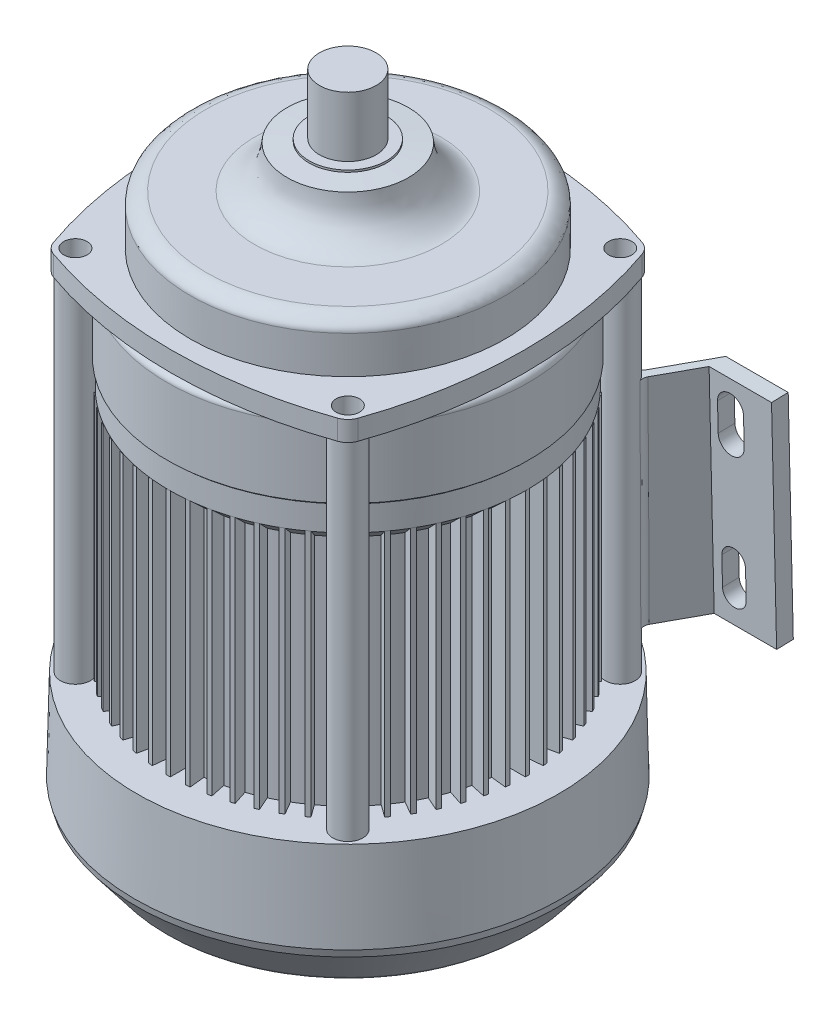
from build123d import *

# Parameters (mm, degrees)
BOSS_EXTRUDE2_REACH = 182.757
CIRPATTERN1_COUNT   = 60
BOSS_EXTRUDE5_START = -6
SKETCH6_R           = 3.5
BOSS_EXTRUDE5_DEPTH = 6
BOSS_EXTRUDE6_START = -110.05
SKETCH6_4_R         = 4.5
SKETCH6_4_R_2       = 3.5
BOSS_EXTRUDE6_DEPTH = 110.05
FILLET2_R           = 5
BOSS_EXTRUDE7_DEPTH = 5
BOSS_EXTRUDE8_DEPTH = 64.9
CUT_EXTRUDE1_START  = -110.05
SKETCH6_5_R         = 3.5
CUT_EXTRUDE1_DEPTH  = 110.05
FILLET3_R           = 2.5
BOSS_EXTRUDE9_DEPTH = 62
FILLET4_R           = 1


with BuildPart() as part:
    # Sketch3 → Revolve4 (revolve)
    with BuildSketch(Plane.XY, mode=Mode.PRIVATE) as revolve4_sk:
        with BuildLine():
            Line((0, -44.5), (0, 8))
            Line((0, 8), (-8.5, 8))
            Line((-8.5, 8), (-8.5, 0))
            Line((-8.5, 0), (-8.5, -10))
            Line((-8.5, -10), (-11.6, -10))
            Line((-11.6, -10), (-11.6, -10.603939151))
            Line((-11.6, -10.603939151), (-18.2, -11.06545611))
            add(Edge.make_bspline(
                [(-18.2, -11.06545611), (-18.483231897, -13.698371795), (-18.796132572, -16.549340939), (-22.617854847, -21.372660686), (-26.27087664, -23.603939151), (-27.95, -23.603939151)],
                knots=[0, 0, 0, 0, 0.4350294, 0.5350294, 1, 1, 1, 1], degree=3))
            Line((-27.95, -23.603939151), (-42.45, -23.603939151))
            add(Edge.make_bspline(
                [(-47.2, -27.253939151), (-47.2, -26.186888604), (-45.306003074, -24.445516164), (-43.516666667, -23.603939151), (-42.45, -23.603939151)],
                knots=[0, 0, 0, 0, 0.468038494, 1, 1, 1, 1], degree=3))
            Line((-47.2, -27.253939151), (-47.2, -44.5))
            Line((-47.2, -44.5), (0, -44.5))
        make_face()
        with BuildLine():
            Line((0, -197), (0, -44.5))
            Line((0, -44.5), (-47.2, -44.5))
            Line((-47.2, -44.5), (-52.9, -44.5))
            ThreePointArc((-52.9, -44.5), (-53.835376053, -45.192237589), (-54.191723747, -46.3))
            Line((-54.191723747, -46.3), (-54.191723747, -66.45))
            Line((-54.191723747, -66.45), (-53.548302521, -67.05))
            Line((-53.548302521, -67.05), (-53.548302521, -74.55))
            Line((-53.548302521, -74.55), (-49.258827681, -78.55))
            Line((-49.258827681, -78.55), (-49.258827681, -148.55))
            Line((-49.258827681, -148.55), (-63.258827681, -148.55))
            Line((-63.258827681, -148.55), (-63.895117946, -175.55))
            Line((-63.895117946, -175.55), (-63.258827681, -177.844388575))
            Line((-63.258827681, -177.844388575), (-54.43307337, -189.344388575))
            add(Edge.make_bspline(
                [(-54.43307337, -189.344388575), (-51.490412959, -193.178689139), (-12.578413701, -196.597750764), (-6.2, -197), (-2, -197)],
                knots=[0, 0, 0, 0, 0.440369242, 1, 1, 1, 1], degree=3))
            Line((-2, -197), (0, -197))
        make_face()
    revolve(revolve4_sk.sketch.rotate(Axis((0, 8, 0), (0, 1, 0)), 270), axis=Axis((0, 8, 0), (0, 1, 0)))

    # Boss-Extrude2: up to this cone (the profile starts outside it)
    boss_extrude2_end = Plane(origin=(0, -148.55, 0), z_dir=(0, 1, 0)).offset(24.065401062) * Cone(1.072e-06, 170.712090672, 159.191598938, align=(Align.CENTER, Align.CENTER, Align.MIN), mode=Mode.PRIVATE)
    # Sketch5 → Boss-Extrude2 (add, up to the surface)
    with BuildSketch(Plane(origin=(0, -148.55, 0), x_dir=(1, 0, 0), z_dir=(0, 1, 0)), mode=Mode.PRIVATE) as boss_extrude2_sk1:
        with BuildLine():
            Line((-0.625, -53.854862496), (0.625, -53.854862496))
            Line((0.625, -53.854862496), (0.625, -49.254862496))
            ThreePointArc((0.625, -49.254862496), (0, -49.258827681), (-0.625, -49.254862496))
            Line((-0.625, -49.254862496), (-0.625, -53.854862496))
        make_face()
    boss_extrude2_tool1 = extrude(boss_extrude2_sk1.sketch, amount=BOSS_EXTRUDE2_REACH, mode=Mode.PRIVATE) - boss_extrude2_end
    boss_extrude2 = boss_extrude2_tool1.solids().sort_by_distance((0, -148.55, 51.556184))[0]
    add(boss_extrude2)

    # CirPattern1: Boss-Extrude2 ×60 about axis
    cirpattern1_axis = Axis((0, 0, 0), (0, 1, 0))
    for i in range(1, CIRPATTERN1_COUNT):
        add(boss_extrude2.rotate(cirpattern1_axis, i * 360 / CIRPATTERN1_COUNT))

    # Sketch6 → Boss-Extrude5 (add)
    with BuildSketch(Plane(origin=(0, -38.5, 0), x_dir=(1, 0, 0), z_dir=(0, 1, 0)).offset(BOSS_EXTRUDE5_START)):
        with BuildLine():
            ThreePointArc((44.841658727, 44.841658727), (52.9, 0), (44.841658727, -44.841658727))
            ThreePointArc((44.841658727, -44.841658727), (0, -52.9), (-44.841658727, -44.841658727))
            ThreePointArc((-44.841658727, -44.841658727), (-52.9, 0), (-44.841658727, 44.841658727))
            ThreePointArc((-44.841658727, 44.841658727), (0, 52.9), (44.841658727, 44.841658727))
        make_face()
        with Locations(Location((40.841658727, 40.841658727, 0), (0, 0, 270))):
            Circle(SKETCH6_R, mode=Mode.SUBTRACT)
        with Locations(Location((40.841658727, -40.841658727, 0), (0, 0, 270))):
            Circle(SKETCH6_R, mode=Mode.SUBTRACT)
        with Locations(Location((-40.841658727, -40.841658727, 0), (0, 0, 270))):
            Circle(SKETCH6_R, mode=Mode.SUBTRACT)
        with Locations(Location((-40.841658727, 40.841658727, 0), (0, 0, 270))):
            Circle(SKETCH6_R, mode=Mode.SUBTRACT)
    extrude(amount=BOSS_EXTRUDE5_DEPTH)

    # Sketch6<4> → Boss-Extrude6 (add)
    # profile 1 of 4: a face of its own
    with BuildSketch(Plane(origin=(0, -38.5, 0), x_dir=(1, 0, 0), z_dir=(0, 1, 0)).offset(BOSS_EXTRUDE6_START)):
        with Locations(Location((40.841658727, 40.841658727, 0), (0, 0, 270))):
            Circle(SKETCH6_4_R)
        with Locations(Location((40.841658727, 40.841658727, 0), (0, 0, 270))):
            Circle(SKETCH6_4_R_2, mode=Mode.SUBTRACT)
    # profile 2 of 4: a face of its own
    with BuildSketch(Plane(origin=(0, -38.5, 0), x_dir=(1, 0, 0), z_dir=(0, 1, 0)).offset(BOSS_EXTRUDE6_START)):
        with Locations(Location((-40.841658727, 40.841658727, 0), (0, 0, 270))):
            Circle(SKETCH6_4_R)
        with Locations(Location((-40.841658727, 40.841658727, 0), (0, 0, 270))):
            Circle(SKETCH6_4_R_2, mode=Mode.SUBTRACT)
    # profile 3 of 4: a face of its own
    with BuildSketch(Plane(origin=(0, -38.5, 0), x_dir=(1, 0, 0), z_dir=(0, 1, 0)).offset(BOSS_EXTRUDE6_START)):
        with Locations(Location((40.841658727, -40.841658727, 0), (0, 0, 270))):
            Circle(SKETCH6_4_R)
        with Locations(Location((40.841658727, -40.841658727, 0), (0, 0, 270))):
            Circle(SKETCH6_4_R_2, mode=Mode.SUBTRACT)
    # profile 4 of 4: a face of its own
    with BuildSketch(Plane(origin=(0, -38.5, 0), x_dir=(1, 0, 0), z_dir=(0, 1, 0)).offset(BOSS_EXTRUDE6_START)):
        with Locations(Location((-40.841658727, -40.841658727, 0), (0, 0, 270))):
            Circle(SKETCH6_4_R)
        with Locations(Location((-40.841658727, -40.841658727, 0), (0, 0, 270))):
            Circle(SKETCH6_4_R_2, mode=Mode.SUBTRACT)
    extrude(amount=BOSS_EXTRUDE6_DEPTH)

    # Fillet2
    fillet2_edges = [part.edges().sort_by_distance(p)[0] for p in [
        (44.841658727, -41.5, 44.841658727),
        (44.841658727, -41.5, -44.841658727),
        (-44.841658727, -41.5, -44.841658727),
        (-44.841658727, -41.5, 44.841658727),
    ]]
    fillet(fillet2_edges, radius=FILLET2_R)



with BuildPart() as body_2:
    # Sketch7 → Boss-Extrude7 (new body)
    with BuildSketch(Plane(origin=(0, 1.407494887, -59.72488345), x_dir=(-1, 0, 0), z_dir=(0, 0.0235597648336108, -0.9997224302180007))):
        Polygon((-58, -137.7), (-70.6, -137.7), (-70.6, -72.8), (-53.75, -72.8), (-51.87924913, -72.8), (-51.87924913, -137.7), align=None)
        with BuildLine():
            Line((-54.56924913, -120.925), (-54.56924913, -129.475))
            ThreePointArc((-54.56924913, -129.475), (-58.11924913, -133.025), (-61.66924913, -129.475))
            Line((-61.66924913, -129.475), (-61.66924913, -120.925))
            ThreePointArc((-61.66924913, -120.925), (-58.11924913, -117.375), (-54.56924913, -120.925))
        make_face(mode=Mode.SUBTRACT)
        with BuildLine():
            Line((-62.01924913, -89.175), (-62.01924913, -80.625))
            ThreePointArc((-62.01924913, -80.625), (-58.11924913, -76.725), (-54.21924913, -80.625))
            Line((-54.21924913, -80.625), (-54.21924913, -89.175))
            ThreePointArc((-54.21924913, -89.175), (-58.11924913, -93.075), (-62.01924913, -89.175))
        make_face(mode=Mode.SUBTRACT)
    boss_extrude7 = extrude(amount=-BOSS_EXTRUDE7_DEPTH)


with BuildPart() as part_1:
    add(part.part)

    add(body_2.part)  # Boss-Extrude8 merges body 2
    # Sketch9 → Boss-Extrude8 (add)
    with BuildSketch(Plane(origin=(0, -137.661778641, -3.244179618), x_dir=(1, 0, 0), z_dir=(0, -0.9997224302180007, -0.023559764833610795))):
        Polygon((51.87924913, -54.741465876), (43.217333512, -39.900052764), (40.841658727, -40.829547756), (51.87924913, -59.741465876), align=None)
    boss_extrude8 = extrude(amount=-BOSS_EXTRUDE8_DEPTH)

    # Mirror2: Boss-Extrude7, Boss-Extrude8 across plane
    add(boss_extrude7.mirror(Plane(origin=(0, 0, 0), x_dir=(0, 0, 1), z_dir=(1, 0, 0))))
    add(boss_extrude8.mirror(Plane(origin=(0, 0, 0), x_dir=(0, 0, 1), z_dir=(1, 0, 0))))

    # Sketch6<5> → Cut-Extrude1 (cut)
    with BuildSketch(Plane(origin=(0, -38.5, 0), x_dir=(1, 0, 0), z_dir=(0, 1, 0)).offset(CUT_EXTRUDE1_START)):
        with Locations(Location((40.841658727, 40.841658727, 0), (0, 0, 270))):
            Circle(SKETCH6_5_R)
        with Locations(Location((-40.841658727, 40.841658727, 0), (0, 0, 270))):
            Circle(SKETCH6_5_R)
    extrude(amount=CUT_EXTRUDE1_DEPTH, mode=Mode.SUBTRACT)

    # Fillet3
    fillet3_edges = [part_1.edges().sort_by_distance(p)[0] for p in [
        (41.95336777, -104.214416884, -45.202175095),
        (44.1233874, -104.244490356, -43.920661311),
        (-44.1233874, -104.244490356, -43.920661311),
        (-41.95336777, -104.214416884, -45.202175095),
    ]]
    fillet(fillet3_edges, radius=FILLET3_R)


with BuildPart() as body_2_2:
    # Split1: the piece on the far side of the plane
    add(part_1.part)
    split(bisect_by=Plane.ZX.offset(-148.55), keep=Keep.BOTTOM)


with BuildPart() as part_2:
    add(part_1.part)

    # Split1
    split(bisect_by=Plane.ZX.offset(-148.55), keep=Keep.TOP)

    # Sketch12 → Boss-Extrude9 (add)
    with BuildSketch(Plane(origin=(0, 0, 0), x_dir=(0, 0, -1), z_dir=(1, 0, 0))):
        with BuildLine():
            Line((11.25, -134.65), (11.25, -124.65))
            ThreePointArc((11.25, -124.65), (15, -120.9), (18.75, -124.65))
            Line((18.75, -124.65), (18.75, -134.65))
            ThreePointArc((18.75, -134.65), (15, -138.4), (11.25, -134.65))
        make_face()
    extrude(amount=-BOSS_EXTRUDE9_DEPTH)

    # Fillet4
    fillet4_edges = [part_2.edges().sort_by_distance(p)[0] for p in [
        (-62, -129.65, -18.75),
        (-62, -138.4, -15),
        (-62, -129.65, -11.25),
        (-62, -120.9, -15),
    ]]
    fillet(fillet4_edges, radius=FILLET4_R)


solid = Compound([body_2_2.part, part_2.part])
